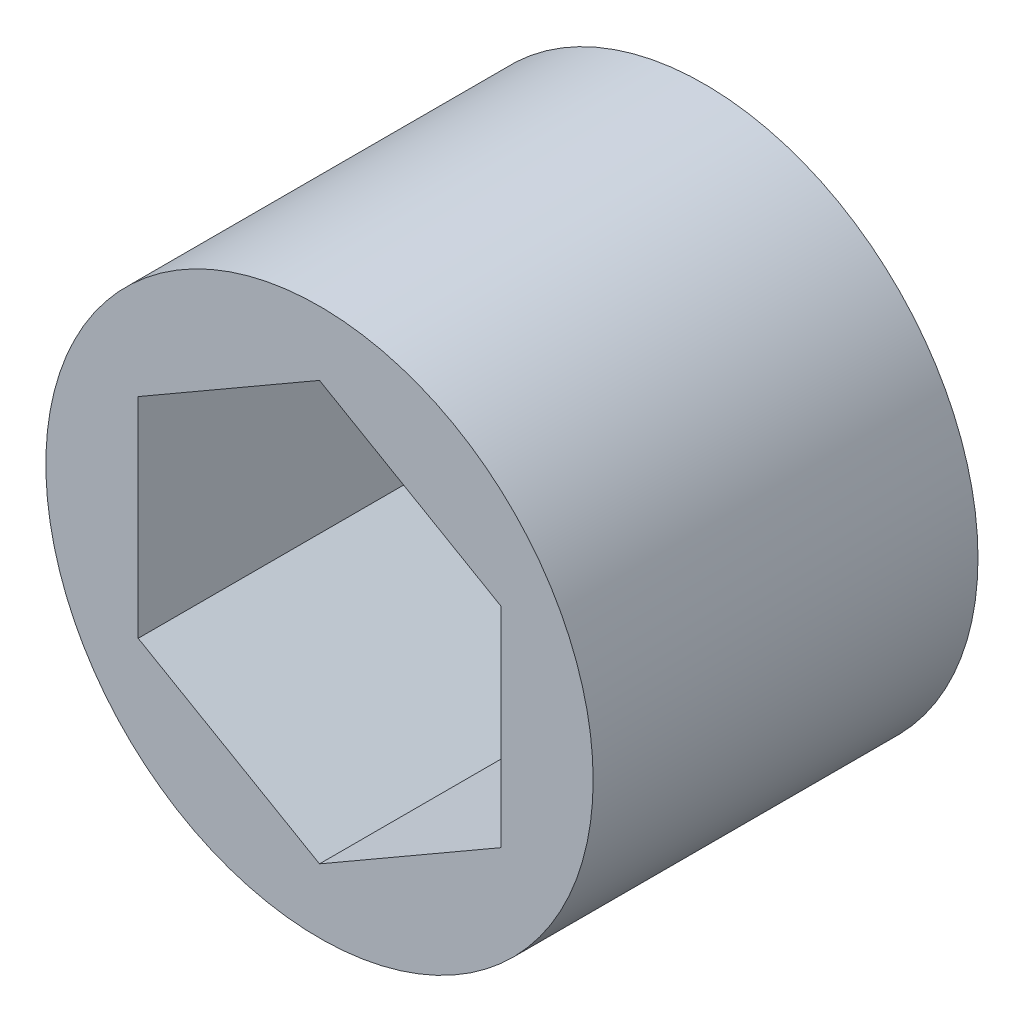
from build123d import *

# Parameters (mm, degrees)
SKETCH1_R           = 10.16
BOSS_EXTRUDE1_DEPTH = 7.14375


with BuildPart() as part:
    # Sketch1 → Boss-Extrude1 (new, symmetric)
    with BuildSketch(Plane.XY):
        Circle(SKETCH1_R)
        Polygon((0, 7.772289324), (-6.731, 3.886144662), (-6.731, -3.886144662), (0, -7.772289324), (6.731, -3.886144662), (6.731, 3.886144662), align=None, mode=Mode.SUBTRACT)
    extrude(amount=BOSS_EXTRUDE1_DEPTH, both=True)


solid = part.part
